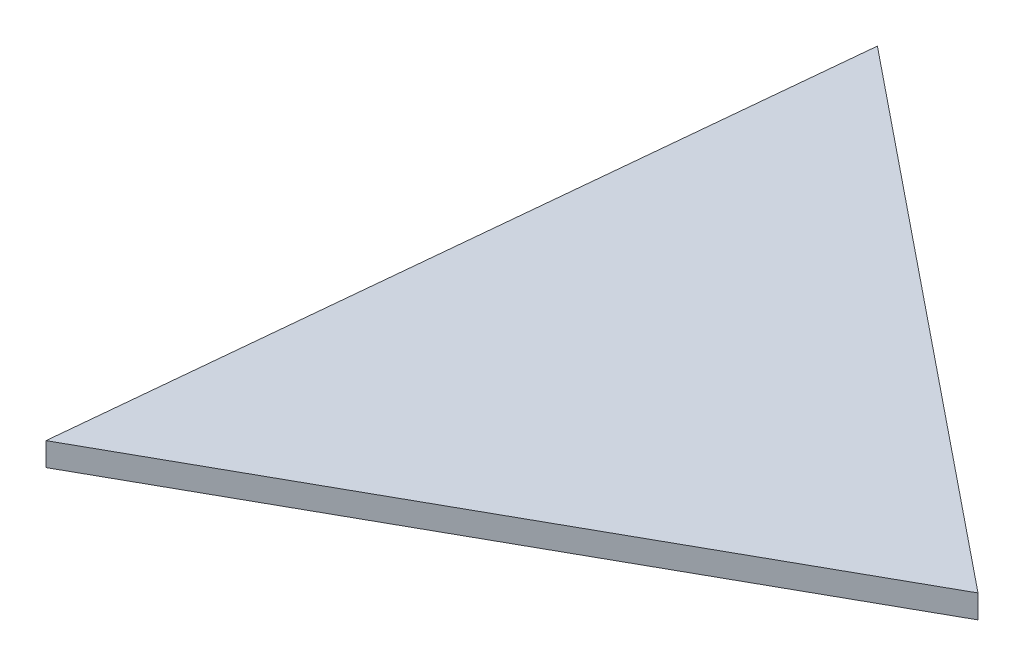
from build123d import *

# Parameters (mm, degrees)
EXTRUDE_1_DEPTH = 2


with BuildPart() as part:
    # 草图1 → 凸台-拉伸1 (new body)
    with BuildSketch(Plane(origin=(0, 0, 0), x_dir=(1, 0, 0), z_dir=(0, 1, 0))):
        Polygon((0, 0), (51.184651096, 28.598408231), (6.337147279, 64.833891388), align=None)
    extrude(amount=EXTRUDE_1_DEPTH)


solid = part.part
